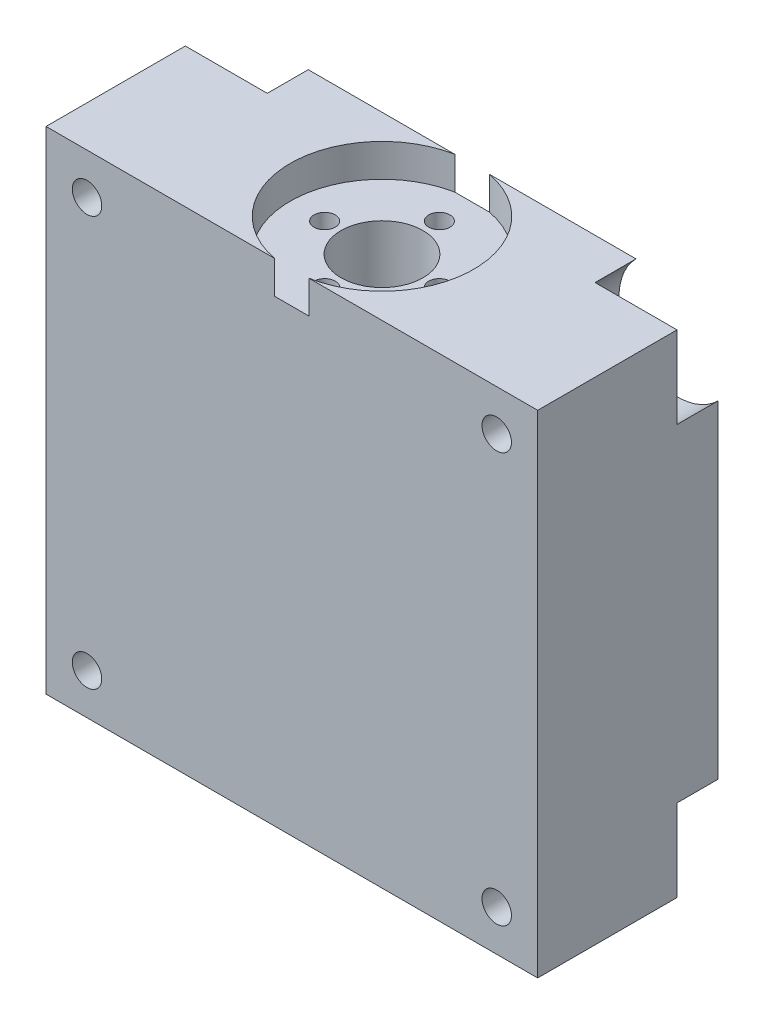
from build123d import *

# Parameters (mm, degrees)
SKETCH1_W           = 60
SKETCH1_H           = 60
SKETCH1_R           = 1.8
BOSS_EXTRUDE1_DEPTH = 22
SKETCH2_R           = 11.2
CUT_EXTRUDE1_DEPTH  = 4
CUT_EXTRUDE2_REACH  = 69.231
SKETCH3_R           = 5
SKETCH4_R           = 7.2
CUT_EXTRUDE3_DEPTH  = 46
SKETCH5_R           = 1.3
CUT_EXTRUDE4_DEPTH  = 6
SKETCH6_R           = 7.071067812
CUT_EXTRUDE5_DEPTH  = 5


with BuildPart() as part:
    # Sketch1 → Boss-Extrude1 (new body)
    with BuildSketch(Plane.XY):
        Rectangle(SKETCH1_W, SKETCH1_H)
        with Locations((-25, 25)):
            Circle(SKETCH1_R, mode=Mode.SUBTRACT)
        with Locations((25, 25)):
            Circle(SKETCH1_R, mode=Mode.SUBTRACT)
        with Locations((25, -25)):
            Circle(SKETCH1_R, mode=Mode.SUBTRACT)
        with Locations((-25, -25)):
            Circle(SKETCH1_R, mode=Mode.SUBTRACT)
    extrude(amount=BOSS_EXTRUDE1_DEPTH)

    # Sketch2 → Cut-Extrude1 (cut)
    with BuildSketch(Plane(origin=(0, 30, 0), x_dir=(1, 0, 0), z_dir=(0, 1, 0))):
        with Locations((0, -11)):
            Circle(SKETCH2_R)
    extrude(amount=-CUT_EXTRUDE1_DEPTH, mode=Mode.SUBTRACT)

    # Sketch3 → Cut-Extrude2 (cut, up to next)
    with BuildSketch(Plane(origin=(0, 26, 0), x_dir=(1, 0, 0), z_dir=(0, 1, 0)), mode=Mode.PRIVATE) as cut_extrude2_sk1:
        with Locations((0, -11)):
            Circle(SKETCH3_R)
    cut_extrude2_tool1 = extrude(cut_extrude2_sk1.sketch, amount=-CUT_EXTRUDE2_REACH, mode=Mode.PRIVATE) & part.part
    add(cut_extrude2_tool1.solids().sort_by_distance((0, 26, 11))[0], mode=Mode.SUBTRACT)

    # Sketch4 → Cut-Extrude3 (cut)
    with BuildSketch(Plane.XZ.offset(30)):
        with Locations((0, 11)):
            Circle(SKETCH4_R)
    extrude(amount=-CUT_EXTRUDE3_DEPTH, mode=Mode.SUBTRACT)

    # Sketch5 → Cut-Extrude4 (cut)
    with BuildSketch(Plane(origin=(0, 26, 0), x_dir=(1, 0, 0), z_dir=(0, 1, 0))):
        with Locations((0, -4)):
            Circle(SKETCH5_R)
        with Locations((7, -11)):
            Circle(SKETCH5_R)
        with Locations((0, -18)):
            Circle(SKETCH5_R)
        with Locations((-7, -11)):
            Circle(SKETCH5_R)
    extrude(amount=-CUT_EXTRUDE4_DEPTH, mode=Mode.SUBTRACT)

    # Sketch6 → Cut-Extrude5 (cut)
    with BuildSketch(Plane(origin=(0, 0, 0), x_dir=(-1, 0, 0), z_dir=(0, 0, -1))):
        with Locations((-25, 25)):
            Circle(SKETCH6_R)
        with Locations((25, 25)):
            Circle(SKETCH6_R)
        with Locations((25, -25)):
            Circle(SKETCH6_R)
        with Locations((-25, -25)):
            Circle(SKETCH6_R)
    extrude(amount=-CUT_EXTRUDE5_DEPTH, mode=Mode.SUBTRACT)


solid = part.part
